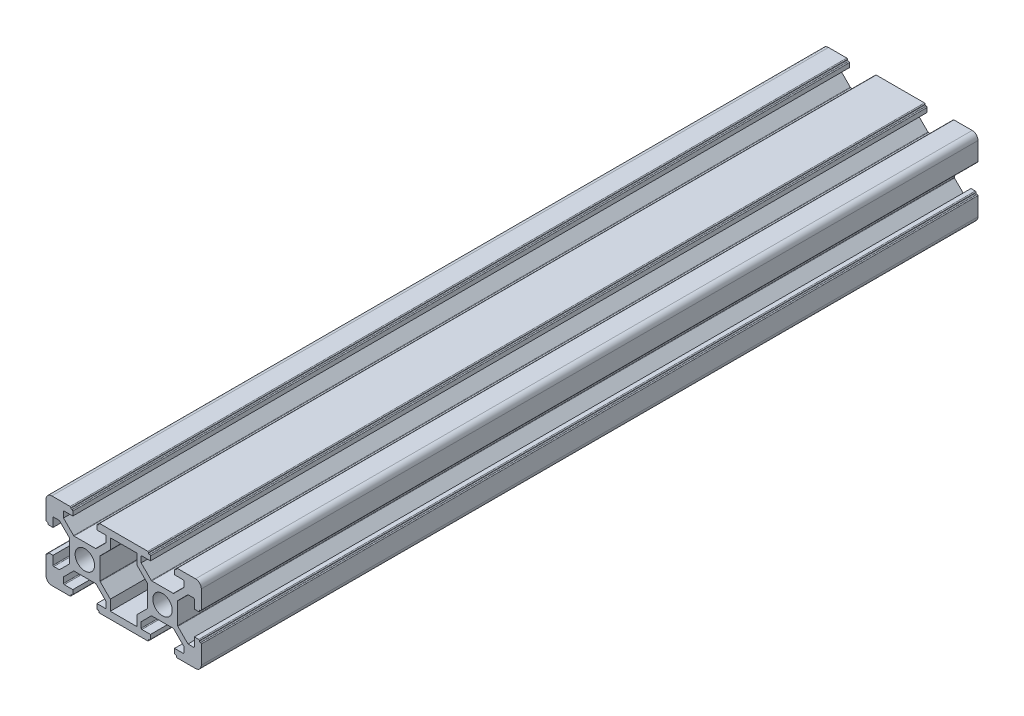
from build123d import *

# Parameters (mm, degrees)
BOSS_EXTRUDE1_DEPTH = 200
SKETCH2_R           = 2.5
CUT_EXTRUDE1_DEPTH  = 203.484567313
SKETCH3_R           = 1.5
CUT_EXTRUDE2_DEPTH  = 10
CUT_EXTRUDE3_DEPTH  = 1


with BuildPart() as part:
    # Sketch1 → Boss-Extrude1 (new body)
    with BuildSketch(Plane.XY):
        with BuildLine():
            Line((-8.5, 10), (-3.8, 10))
            ThreePointArc((-3.8, 10), (-3.658578644, 9.941421356), (-3.6, 9.8))
            Line((-3.6, 9.8), (-3.6, 9.7))
            ThreePointArc((-3.6, 9.7), (-3.541421356, 9.558578644), (-3.4, 9.5))
            Line((-3.4, 9.5), (-3.3, 9.5))
            ThreePointArc((-3.3, 9.5), (-3.158578644, 9.441421356), (-3.1, 9.3))
            Line((-3.1, 9.3), (-3.1, 8.2))
            Line((-3.1, 8.2), (-5.3, 8.2))
            ThreePointArc((-5.3, 8.2), (-5.441421356, 8.141421356), (-5.5, 8))
            Line((-5.5, 8), (-5.5, 6.560660172))
            Line((-5.5, 6.560660172), (-2.897918472, 3.958578644))
            ThreePointArc((-2.897918472, 3.958578644), (-2.833033802, 3.915224093), (-2.756497116, 3.9))
            Line((-2.756497116, 3.9), (2.756497116, 3.9))
            ThreePointArc((2.756497116, 3.9), (2.833033802, 3.915224093), (2.897918472, 3.958578644))
            Line((2.897918472, 3.958578644), (5.5, 6.560660172))
            Line((5.5, 6.560660172), (5.5, 8))
            ThreePointArc((5.5, 8), (5.441421356, 8.141421356), (5.3, 8.2))
            Line((5.3, 8.2), (3.1, 8.2))
            Line((3.1, 8.2), (3.1, 9.3))
            ThreePointArc((3.1, 9.3), (3.158578644, 9.441421356), (3.3, 9.5))
            Line((3.3, 9.5), (3.4, 9.5))
            ThreePointArc((3.4, 9.5), (3.541421356, 9.558578644), (3.6, 9.7))
            Line((3.6, 9.7), (3.6, 9.8))
            ThreePointArc((3.6, 9.8), (3.658578644, 9.941421356), (3.8, 10))
            Line((3.8, 10), (8.5, 10))
            Line((8.5, 10), (11.5, 10))
            Line((11.5, 10), (16.2, 10))
            ThreePointArc((16.2, 10), (16.341421356, 9.941421356), (16.4, 9.8))
            Line((16.4, 9.8), (16.4, 9.7))
            ThreePointArc((16.4, 9.7), (16.458578644, 9.558578644), (16.6, 9.5))
            Line((16.6, 9.5), (16.7, 9.5))
            ThreePointArc((16.7, 9.5), (16.841421356, 9.441421356), (16.9, 9.3))
            Line((16.9, 9.3), (16.9, 8.2))
            Line((16.9, 8.2), (14.7, 8.2))
            ThreePointArc((14.7, 8.2), (14.558578644, 8.141421356), (14.5, 8))
            Line((14.5, 8), (14.5, 6.560660172))
            Line((14.5, 6.560660172), (17.102081528, 3.958578644))
            ThreePointArc((17.102081528, 3.958578644), (17.166966198, 3.915224093), (17.243502884, 3.9))
            Line((17.243502884, 3.9), (22.756497116, 3.9))
            ThreePointArc((22.756497116, 3.9), (22.833033802, 3.915224093), (22.897918472, 3.958578644))
            Line((22.897918472, 3.958578644), (25.5, 6.560660172))
            Line((25.5, 6.560660172), (25.5, 8))
            ThreePointArc((25.5, 8), (25.441421356, 8.141421356), (25.3, 8.2))
            Line((25.3, 8.2), (23.1, 8.2))
            Line((23.1, 8.2), (23.1, 9.3))
            ThreePointArc((23.1, 9.3), (23.158578644, 9.441421356), (23.3, 9.5))
            Line((23.3, 9.5), (23.4, 9.5))
            ThreePointArc((23.4, 9.5), (23.541421356, 9.558578644), (23.6, 9.7))
            Line((23.6, 9.7), (23.6, 9.8))
            ThreePointArc((23.6, 9.8), (23.658578644, 9.941421356), (23.8, 10))
            Line((23.8, 10), (28.5, 10))
            ThreePointArc((28.5, 10), (29.560660172, 9.560660172), (30, 8.5))
            Line((30, 8.5), (30, 3.8))
            ThreePointArc((30, 3.8), (29.941421356, 3.658578644), (29.8, 3.6))
            Line((29.8, 3.6), (29.7, 3.6))
            ThreePointArc((29.7, 3.6), (29.558578644, 3.541421356), (29.5, 3.4))
            Line((29.5, 3.4), (29.5, 3.3))
            ThreePointArc((29.5, 3.3), (29.441421356, 3.158578644), (29.3, 3.1))
            Line((29.3, 3.1), (28.2, 3.1))
            Line((28.2, 3.1), (28.2, 5.3))
            ThreePointArc((28.2, 5.3), (28.141421356, 5.441421356), (28, 5.5))
            Line((28, 5.5), (26.560660172, 5.5))
            Line((26.560660172, 5.5), (23.958578644, 2.897918472))
            ThreePointArc((23.958578644, 2.897918472), (23.915224093, 2.833033802), (23.9, 2.756497116))
            Line((23.9, 2.756497116), (23.9, -2.756497116))
            ThreePointArc((23.9, -2.756497116), (23.915224093, -2.833033802), (23.958578644, -2.897918472))
            Line((23.958578644, -2.897918472), (26.560660172, -5.5))
            Line((26.560660172, -5.5), (28, -5.5))
            ThreePointArc((28, -5.5), (28.141421356, -5.441421356), (28.2, -5.3))
            Line((28.2, -5.3), (28.2, -3.1))
            Line((28.2, -3.1), (29.3, -3.1))
            ThreePointArc((29.3, -3.1), (29.441421356, -3.158578644), (29.5, -3.3))
            Line((29.5, -3.3), (29.5, -3.4))
            ThreePointArc((29.5, -3.4), (29.558578644, -3.541421356), (29.7, -3.6))
            Line((29.7, -3.6), (29.8, -3.6))
            ThreePointArc((29.8, -3.6), (29.941421356, -3.658578644), (30, -3.8))
            Line((30, -3.8), (30, -8.5))
            ThreePointArc((30, -8.5), (29.560660172, -9.560660172), (28.5, -10))
            Line((28.5, -10), (23.8, -10))
            ThreePointArc((23.8, -10), (23.658578644, -9.941421356), (23.6, -9.8))
            Line((23.6, -9.8), (23.6, -9.7))
            ThreePointArc((23.6, -9.7), (23.541421356, -9.558578644), (23.4, -9.5))
            Line((23.4, -9.5), (23.3, -9.5))
            ThreePointArc((23.3, -9.5), (23.158578644, -9.441421356), (23.1, -9.3))
            Line((23.1, -9.3), (23.1, -8.2))
            Line((23.1, -8.2), (25.3, -8.2))
            ThreePointArc((25.3, -8.2), (25.441421356, -8.141421356), (25.5, -8))
            Line((25.5, -8), (25.5, -6.560660172))
            Line((25.5, -6.560660172), (22.897918472, -3.958578644))
            ThreePointArc((22.897918472, -3.958578644), (22.833033802, -3.915224093), (22.756497116, -3.9))
            Line((22.756497116, -3.9), (17.243502884, -3.9))
            ThreePointArc((17.243502884, -3.9), (17.166966198, -3.915224093), (17.102081528, -3.958578644))
            Line((17.102081528, -3.958578644), (14.5, -6.560660172))
            Line((14.5, -6.560660172), (14.5, -8))
            ThreePointArc((14.5, -8), (14.558578644, -8.141421356), (14.7, -8.2))
            Line((14.7, -8.2), (16.9, -8.2))
            Line((16.9, -8.2), (16.9, -9.3))
            ThreePointArc((16.9, -9.3), (16.841421356, -9.441421356), (16.7, -9.5))
            Line((16.7, -9.5), (16.6, -9.5))
            ThreePointArc((16.6, -9.5), (16.458578644, -9.558578644), (16.4, -9.7))
            Line((16.4, -9.7), (16.4, -9.8))
            ThreePointArc((16.4, -9.8), (16.341421356, -9.941421356), (16.2, -10))
            Line((16.2, -10), (11.5, -10))
            Line((11.5, -10), (8.5, -10))
            Line((8.5, -10), (3.8, -10))
            ThreePointArc((3.8, -10), (3.658578644, -9.941421356), (3.6, -9.8))
            Line((3.6, -9.8), (3.6, -9.7))
            ThreePointArc((3.6, -9.7), (3.541421356, -9.558578644), (3.4, -9.5))
            Line((3.4, -9.5), (3.3, -9.5))
            ThreePointArc((3.3, -9.5), (3.158578644, -9.441421356), (3.1, -9.3))
            Line((3.1, -9.3), (3.1, -8.2))
            Line((3.1, -8.2), (5.3, -8.2))
            ThreePointArc((5.3, -8.2), (5.441421356, -8.141421356), (5.5, -8))
            Line((5.5, -8), (5.5, -6.560660172))
            Line((5.5, -6.560660172), (2.897918472, -3.958578644))
            ThreePointArc((2.897918472, -3.958578644), (2.833033802, -3.915224093), (2.756497116, -3.9))
            Line((2.756497116, -3.9), (-2.756497116, -3.9))
            ThreePointArc((-2.756497116, -3.9), (-2.833033802, -3.915224093), (-2.897918472, -3.958578644))
            Line((-2.897918472, -3.958578644), (-5.5, -6.560660172))
            Line((-5.5, -6.560660172), (-5.5, -8))
            ThreePointArc((-5.5, -8), (-5.441421356, -8.141421356), (-5.3, -8.2))
            Line((-5.3, -8.2), (-3.1, -8.2))
            Line((-3.1, -8.2), (-3.1, -9.3))
            ThreePointArc((-3.1, -9.3), (-3.158578644, -9.441421356), (-3.3, -9.5))
            Line((-3.3, -9.5), (-3.4, -9.5))
            ThreePointArc((-3.4, -9.5), (-3.541421356, -9.558578644), (-3.6, -9.7))
            Line((-3.6, -9.7), (-3.6, -9.8))
            ThreePointArc((-3.6, -9.8), (-3.658578644, -9.941421356), (-3.8, -10))
            Line((-3.8, -10), (-8.5, -10))
            ThreePointArc((-8.5, -10), (-9.560660172, -9.560660172), (-10, -8.5))
            Line((-10, -8.5), (-10, -3.8))
            ThreePointArc((-10, -3.8), (-9.941421356, -3.658578644), (-9.8, -3.6))
            Line((-9.8, -3.6), (-9.7, -3.6))
            ThreePointArc((-9.7, -3.6), (-9.558578644, -3.541421356), (-9.5, -3.4))
            Line((-9.5, -3.4), (-9.5, -3.3))
            ThreePointArc((-9.5, -3.3), (-9.441421356, -3.158578644), (-9.3, -3.1))
            Line((-9.3, -3.1), (-8.2, -3.1))
            Line((-8.2, -3.1), (-8.2, -5.3))
            ThreePointArc((-8.2, -5.3), (-8.141421356, -5.441421356), (-8, -5.5))
            Line((-8, -5.5), (-6.560660172, -5.5))
            Line((-6.560660172, -5.5), (-3.958578644, -2.897918472))
            ThreePointArc((-3.958578644, -2.897918472), (-3.915224093, -2.833033802), (-3.9, -2.756497116))
            Line((-3.9, -2.756497116), (-3.9, 2.756497116))
            ThreePointArc((-3.9, 2.756497116), (-3.915224093, 2.833033802), (-3.958578644, 2.897918472))
            Line((-3.958578644, 2.897918472), (-6.560660172, 5.5))
            Line((-6.560660172, 5.5), (-8, 5.5))
            ThreePointArc((-8, 5.5), (-8.141421356, 5.441421356), (-8.2, 5.3))
            Line((-8.2, 5.3), (-8.2, 3.1))
            Line((-8.2, 3.1), (-9.3, 3.1))
            ThreePointArc((-9.3, 3.1), (-9.441421356, 3.158578644), (-9.5, 3.3))
            Line((-9.5, 3.3), (-9.5, 3.4))
            ThreePointArc((-9.5, 3.4), (-9.558578644, 3.541421356), (-9.7, 3.6))
            Line((-9.7, 3.6), (-9.8, 3.6))
            ThreePointArc((-9.8, 3.6), (-9.941421356, 3.658578644), (-10, 3.8))
            Line((-10, 3.8), (-10, 8.5))
            ThreePointArc((-10, 8.5), (-9.560660172, 9.560660172), (-8.5, 10))
        make_face()
        with BuildLine():
            Line((3.9, 2.756497116), (3.9, -2.756497116))
            ThreePointArc((3.9, -2.756497116), (3.915224093, -2.833033802), (3.958578644, -2.897918472))
            Line((3.958578644, -2.897918472), (6.560660172, -5.5))
            Line((6.560660172, -5.5), (6.560660172, -8.2))
            Line((6.560660172, -8.2), (13.439339828, -8.2))
            Line((13.439339828, -8.2), (13.439339828, -5.5))
            Line((13.439339828, -5.5), (16.041421356, -2.897918472))
            ThreePointArc((16.041421356, -2.897918472), (16.084775907, -2.833033802), (16.1, -2.756497116))
            Line((16.1, -2.756497116), (16.1, 2.756497116))
            ThreePointArc((16.1, 2.756497116), (16.084775907, 2.833033802), (16.041421356, 2.897918472))
            Line((16.041421356, 2.897918472), (13.439339828, 5.5))
            Line((13.439339828, 5.5), (13.439339828, 8.2))
            Line((13.439339828, 8.2), (6.560660172, 8.2))
            Line((6.560660172, 8.2), (6.560660172, 5.5))
            Line((6.560660172, 5.5), (3.958578644, 2.897918472))
            ThreePointArc((3.958578644, 2.897918472), (3.915224093, 2.833033802), (3.9, 2.756497116))
        make_face(mode=Mode.SUBTRACT)
    extrude(amount=BOSS_EXTRUDE1_DEPTH)

    # Sketch2 → Cut-Extrude1 (cut, through all)
    with BuildSketch(Plane.XY.offset(200)):
        Circle(SKETCH2_R)
        with Locations((20, 0)):
            Circle(SKETCH2_R)
    extrude(amount=-CUT_EXTRUDE1_DEPTH, mode=Mode.SUBTRACT)

    # Sketch3 → Cut-Extrude2 (cut)
    with BuildSketch(Plane.XZ.offset(3.9)):
        with Locations((20, 183.3)):
            Circle(SKETCH3_R)
        with Locations((20, 166.6)):
            Circle(SKETCH3_R)
        with Locations((0, 166.6)):
            Circle(SKETCH3_R)
        with Locations((0, 183.3)):
            Circle(SKETCH3_R)
    extrude(amount=-CUT_EXTRUDE2_DEPTH, mode=Mode.SUBTRACT)

    # Sketch4 → Cut-Extrude3 (cut)
    # profile 1 of 7: a face of its own
    with BuildSketch(Plane.XZ.offset(10)):
        with BuildLine():
            Line((5.405689325, 199.018538248), (4.398870658, 198.515128915))
            add(Edge.make_bspline(
                [(4.398870658, 198.515128915), (4.375470361, 198.504007187), (4.332287922, 198.483483372), (4.272890674, 198.454114045), (4.223964892, 198.429334287), (4.175163438, 198.401811983), (4.124432953, 198.37568004), (4.075408852, 198.36254351), (4.043274946, 198.358682258), (4.026000646, 198.35704289), (4.015934415, 198.356490843), (4.007102707, 198.357946256), (4.009027033, 198.366735391), (4.010780376, 198.371430848), (4.011804816, 198.374174302)],
                knots=[0, 0, 0, 0, 2.113482073, 3.900177315, 5.405807338, 6.585701353, 8.47248579, 10.046621559, 10.680507243, 11.128502661, 11.432699657, 11.560960372, 11.74347857, 12, 12, 12, 12], degree=3))
            add(Edge.make_bspline(
                [(4.011804816, 198.374174302), (4.012253079, 198.380189599), (4.013076615, 198.391240727), (4.019572333, 198.409113814), (4.036067403, 198.42879124), (4.04867769, 198.444752576), (4.056552312, 198.454719795)],
                knots=[0, 0, 0, 0, 0.76500436, 1.405443559, 2.379802743, 4, 4, 4, 4], degree=3))
            Line((4.056552312, 198.454719795), (4.142318346, 198.570317494))
            add(Edge.make_bspline(
                [(4.142318346, 198.570317494), (4.15329164, 198.586113956), (4.172345099, 198.613542117), (4.199206632, 198.647089641), (4.215949289, 198.669007008), (4.229005362, 198.681559753), (4.24333129, 198.683175519), (4.261250243, 198.685834774), (4.287282369, 198.686727747), (4.320596735, 198.688042176), (4.360200719, 198.691165548), (4.404361497, 198.700587741), (4.452258254, 198.715172829), (4.520188989, 198.739676534), (4.602153471, 198.774120727), (4.666179305, 198.803356193), (4.696441509, 198.817174515)],
                knots=[0, 0, 0, 0, 1.27946367, 2.221594617, 2.843686471, 3.137924783, 3.374542097, 3.774254406, 4.353610435, 5.098017717, 5.994242814, 6.989243992, 8.092537102, 9.32092557, 11.788406741, 14, 14, 14, 14], degree=3))
            Line((4.696441509, 198.817174515), (5.240123588, 199.093863201))
            Line((5.240123588, 199.093863201), (4.328766248, 199.536863414))
            Line((4.328766248, 199.536863414), (4.112486682, 199.647240571))
            add(Edge.make_bspline(
                [(4.112486682, 199.647240571), (4.097898348, 199.655501066), (4.070009846, 199.671292643), (4.038919052, 199.692667929), (4.017120497, 199.707598639), (4.009217413, 199.71634861), (4.002107957, 199.723193104), (4.008116126, 199.731210193), (4.021424767, 199.73363871), (4.036512774, 199.740512061), (4.054434497, 199.744047682), (4.074177091, 199.745236018), (4.099084921, 199.745155522), (4.117462818, 199.744047151), (4.127402514, 199.743447688)],
                knots=[0, 0, 0, 0, 2.288612866, 4.375138456, 5.226165039, 5.803861041, 6.12500379, 6.323495593, 6.994026778, 7.930620101, 8.591577993, 9.479260322, 10.636656475, 12, 12, 12, 12], degree=3))
            Line((4.127402514, 199.743447688), (4.257916045, 199.733006606))
            Line((4.257916045, 199.733006606), (4.434668655, 199.718090773))
            add(Edge.make_bspline(
                [(4.434668655, 199.718090773), (4.442798302, 199.717743015), (4.455997342, 199.717178404), (4.472512014, 199.715086219), (4.481778019, 199.706808802), (4.486840316, 199.694517903), (4.494639887, 199.677910897), (4.50171184, 199.655674874), (4.513291828, 199.630467306), (4.533667941, 199.606610137), (4.558240915, 199.581083988), (4.603682973, 199.549072968), (4.671125734, 199.508908743), (4.729979723, 199.480920017), (4.761325378, 199.466013211)],
                knots=[0, 0, 0, 0, 0.684866172, 1.111927356, 1.332136251, 1.684299924, 2.203842278, 2.865766853, 3.625492481, 4.495790489, 5.462563622, 6.5729227, 9.109536716, 12, 12, 12, 12], degree=3))
            Line((4.761325378, 199.466013211), (5.381078202, 199.179629235))
            Line((5.381078202, 199.179629235), (6.025442148, 199.481674835))
            add(Edge.make_bspline(
                [(6.025442148, 199.481674835), (6.05530856, 199.496272179), (6.108947914, 199.522488657), (6.180320583, 199.558497987), (6.233692898, 199.586302366), (6.281250563, 199.613305969), (6.327826598, 199.644610778), (6.375662216, 199.683450324), (6.41605415, 199.717956353), (6.439153764, 199.73941885), (6.448305988, 199.747922438)],
                knots=[0, 0, 0, 0, 1.58777371, 2.851603225, 3.818285944, 4.461889746, 5.463034698, 6.494081497, 7.403344846, 8, 8, 8, 8], degree=3))
            Line((6.448305988, 199.747922438), (6.488578734, 199.793415726))
            Line((6.488578734, 199.793415726), (6.548987854, 199.768058811))
            Line((6.548987854, 199.768058811), (6.468442361, 199.476454294))
            add(Edge.make_bspline(
                [(6.468442361, 199.476454294), (6.454765304, 199.476160185), (6.430330339, 199.475634742), (6.396247104, 199.472183634), (6.36632575, 199.464467027), (6.33957438, 199.45683859), (6.310871469, 199.44563242), (6.275913336, 199.430777178), (6.228102187, 199.407721606), (6.191526816, 199.390639686), (6.170871511, 199.380992968)],
                knots=[0, 0, 0, 0, 1.039349584, 1.856866603, 2.594340973, 3.382992685, 3.968725486, 4.933329466, 6.268151062, 8, 8, 8, 8], degree=3))
            Line((6.170871511, 199.380992968), (5.546643938, 199.099083742))
            Line((5.546643938, 199.099083742), (6.201448967, 198.781376518))
            add(Edge.make_bspline(
                [(6.201448967, 198.781376518), (6.216388546, 198.77446763), (6.244045917, 198.761677332), (6.281972644, 198.743244362), (6.314469997, 198.72952267), (6.35069139, 198.712203074), (6.399600412, 198.694102045), (6.46236425, 198.676183856), (6.52343932, 198.660223428), (6.562369955, 198.653643316), (6.578819518, 198.650862987)],
                knots=[0, 0, 0, 0, 0.985086527, 1.823672732, 2.523088216, 3.095642457, 4.225768838, 5.637986055, 7.001965939, 8, 8, 8, 8], degree=3))
            Line((6.578819518, 198.650862987), (6.664585553, 198.645642446))
            Line((6.664585553, 198.645642446), (6.674280844, 198.590453867))
            Line((6.674280844, 198.590453867), (6.241721713, 198.504687833))
            add(Edge.make_bspline(
                [(6.241721713, 198.504687833), (6.23823433, 198.514371131), (6.231574374, 198.532863604), (6.221091921, 198.562518515), (6.198785569, 198.594606518), (6.15959203, 198.630369869), (6.100961347, 198.670859724), (6.052495107, 198.693444925), (6.025442148, 198.706051566)],
                knots=[0, 0, 0, 0, 0.60425042, 1.153954364, 1.837467463, 2.868811726, 4.252228599, 6, 6, 6, 6], degree=3))
            Line((6.025442148, 198.706051566), (5.405689325, 199.018538248))
        make_face()
    # profile 2 of 7: a face of its own
    with BuildSketch(Plane.XZ.offset(10)):
        with BuildLine():
            add(Edge.make_bspline(
                [(4.4040912, 196.055508204), (4.384216489, 196.057882732), (4.346997055, 196.062329519), (4.294245342, 196.066571171), (4.248510275, 196.070056996), (4.198756615, 196.070466993), (4.146956296, 196.071176363), (4.102335148, 196.077261002), (4.07415018, 196.084260026), (4.062177042, 196.090169095), (4.053422268, 196.097553171), (4.055523495, 196.102872), (4.056552312, 196.105476241)],
                knots=[0, 0, 0, 0, 1.654098457, 3.097635461, 4.374174197, 5.442795876, 7.210879807, 8.643407929, 9.176829156, 9.572051243, 9.790464788, 10, 10, 10, 10], degree=3))
            add(Edge.make_bspline(
                [(4.056552312, 196.105476241), (4.057302367, 196.106466384), (4.060512786, 196.110704437), (4.06738508, 196.121029708), (4.086100252, 196.132617716), (4.102626873, 196.137572447), (4.112486682, 196.140528447)],
                knots=[0, 0, 0, 0, 0.220129113, 0.942206293, 2.175715252, 4, 4, 4, 4], degree=3))
            Line((4.112486682, 196.140528447), (4.177370552, 196.165885361))
            Line((4.177370552, 196.165885361), (4.389175368, 196.236735564))
            add(Edge.make_bspline(
                [(4.389175368, 196.236735564), (4.400593788, 196.240264982), (4.42111392, 196.246607727), (4.448372499, 196.254339678), (4.468818525, 196.258367632), (4.48834553, 196.259969011), (4.511832299, 196.253553249), (4.542612438, 196.23943904), (4.583441094, 196.225051471), (4.631568032, 196.210577435), (4.68327943, 196.198619484), (4.730132299, 196.19331978), (4.775985927, 196.191755609), (4.82770538, 196.190416568), (4.897049566, 196.187912278), (4.949262909, 196.186698131), (4.978350735, 196.186021734)],
                knots=[0, 0, 0, 0, 0.834378348, 1.499467721, 1.97595881, 2.288790536, 2.857210041, 3.64346534, 4.659010869, 5.872341409, 7.15221937, 8.357582129, 9.156564213, 10.354409044, 11.969057202, 14, 14, 14, 14], degree=3))
            Line((4.978350735, 196.186021734), (6.780183252, 196.180801193))
            add(Edge.make_bspline(
                [(6.780183252, 196.180801193), (6.818222881, 196.18131292), (6.889617281, 196.18227335), (6.991667487, 196.187184874), (7.085337941, 196.196849738), (7.159150604, 196.205877921), (7.21351823, 196.21391693), (7.246757316, 196.219371267), (7.272939198, 196.222822902), (7.28782293, 196.225272362), (7.294033667, 196.226294481)],
                knots=[0, 0, 0, 0, 1.76776236, 3.317811778, 4.745426959, 6.142428608, 6.773033178, 7.299115075, 7.707532242, 8, 8, 8, 8], degree=3))
            Line((7.294033667, 196.226294481), (7.37457916, 196.251651396))
            Line((7.37457916, 196.251651396), (7.424547198, 196.206158108))
            Line((7.424547198, 196.206158108), (7.122501598, 195.984658001))
            add(Edge.make_bspline(
                [(7.122501598, 195.984658001), (7.106792042, 195.989229505), (7.077266637, 195.99782144), (7.033452602, 196.013224174), (6.984523316, 196.025992372), (6.936000478, 196.034049936), (6.886662293, 196.039643793), (6.837930845, 196.043603894), (6.779437464, 196.044388221), (6.737174157, 196.044830435), (6.71455359, 196.045067121)],
                knots=[0, 0, 0, 0, 0.945941833, 1.777855114, 2.684418718, 3.866092074, 4.618573467, 5.555736068, 6.691757972, 8, 8, 8, 8], degree=3))
            Line((6.71455359, 196.045067121), (6.216364799, 196.045067121))
            add(Edge.make_bspline(
                [(6.216364799, 196.045067121), (6.228047757, 196.037609047), (6.254259347, 196.020876302), (6.289042842, 195.998688844), (6.320976338, 195.975618313), (6.348604695, 195.952674831), (6.377479106, 195.922979912), (6.408333712, 195.889182808), (6.437297735, 195.850312154), (6.461247121, 195.8068071), (6.475675563, 195.75840432), (6.48077237, 195.724944754), (6.483358193, 195.707969316)],
                knots=[0, 0, 0, 0, 0.929261729, 2.08486808, 2.76490863, 3.569370846, 4.488565088, 5.539043116, 6.635702196, 7.731727918, 8.849210703, 10, 10, 10, 10], degree=3))
            add(Edge.make_bspline(
                [(6.483358193, 195.707969316), (6.483964034, 195.688015301), (6.485181789, 195.647907207), (6.471304761, 195.58822165), (6.447253188, 195.529747137), (6.410907536, 195.47473936), (6.367396125, 195.42283613), (6.316720744, 195.376415158), (6.26088689, 195.334858228), (6.179001435, 195.290881849), (6.073882122, 195.247537053), (5.965381294, 195.217027418), (5.875415184, 195.201792714), (5.801403839, 195.190174151), (5.719439106, 195.181234907), (5.597383633, 195.167332262), (5.430748371, 195.155830796), (5.221289507, 195.150200009), (5.007488261, 195.152761624), (4.866170443, 195.167017291), (4.797123375, 195.173982527)],
                knots=[0, 0, 0, 0, 0.551888208, 1.109309806, 1.68450244, 2.298740058, 2.930242627, 3.559934216, 4.201491226, 4.856080764, 6.133284784, 7.349947576, 7.973717169, 8.664419706, 9.428487307, 10.26109817, 12.073136923, 14.060545576, 16.075205358, 18, 18, 18, 18], degree=3))
            add(Edge.make_bspline(
                [(4.797123375, 195.173982527), (4.761986631, 195.178984069), (4.694881383, 195.188536169), (4.60037292, 195.20948379), (4.515498917, 195.230096306), (4.44151369, 195.255446532), (4.37769018, 195.283645258), (4.321740428, 195.311466111), (4.274856394, 195.341936662), (4.224349131, 195.382958325), (4.176465257, 195.440651833), (4.138135764, 195.515591842), (4.11810568, 195.590558136), (4.117326779, 195.639513353), (4.116961432, 195.662476028)],
                knots=[0, 0, 0, 0, 1.381403856, 2.638248161, 3.767543458, 4.780811365, 5.678190839, 6.483442268, 7.211059005, 7.850603229, 9.01192915, 10.098557327, 11.108119387, 12, 12, 12, 12], degree=3))
            add(Edge.make_bspline(
                [(4.116961432, 195.662476028), (4.117550152, 195.677931043), (4.11874658, 195.709339527), (4.128320999, 195.756864877), (4.143438425, 195.805528076), (4.163661188, 195.854218467), (4.188748987, 195.900034866), (4.219657322, 195.938439058), (4.254147685, 195.96954379), (4.280694683, 195.983187367), (4.293714042, 195.989878543)],
                knots=[0, 0, 0, 0, 0.950081545, 1.930805051, 2.970780528, 4.081223131, 5.169973651, 6.170642917, 7.102834297, 8, 8, 8, 8], degree=3))
            Line((4.293714042, 195.989878543), (4.4040912, 196.055508204))
        make_face()
        with BuildLine():
            add(Edge.make_bspline(
                [(5.038759855, 196.050287662), (4.996489995, 196.050170535), (4.918114097, 196.049953358), (4.808063687, 196.044137844), (4.710382826, 196.033428906), (4.619244126, 196.014029216), (4.528765897, 195.981896212), (4.455821479, 195.941737622), (4.399915368, 195.903584685), (4.362778465, 195.87307867), (4.334739688, 195.839120558), (4.312308428, 195.80453357), (4.297151469, 195.767851029), (4.288136202, 195.729329635), (4.285221381, 195.688814329), (4.287390121, 195.661471352), (4.288493501, 195.647560196)],
                knots=[0, 0, 0, 0, 1.845917827, 3.422662539, 4.811160948, 6.133693706, 7.483401613, 8.989439591, 9.754418173, 10.439823622, 11.079316246, 11.669733515, 12.234328133, 12.803187042, 13.391103168, 14, 14, 14, 14], degree=3))
            add(Edge.make_bspline(
                [(4.288493501, 195.647560196), (4.290354556, 195.626207407), (4.2941286, 195.582905982), (4.316584073, 195.531205596), (4.345632005, 195.493106041), (4.376928656, 195.465114941), (4.416049909, 195.436921812), (4.462647001, 195.408606766), (4.516617039, 195.383364261), (4.575703602, 195.359766128), (4.640351925, 195.341034855), (4.70957892, 195.323378949), (4.784436077, 195.310501049), (4.864256458, 195.29974057), (4.9494463, 195.293656393), (5.067020119, 195.287639499), (5.209798048, 195.286745046), (5.322412195, 195.285633164), (5.37585766, 195.285105476)],
                knots=[0, 0, 0, 0, 0.824770147, 1.672555393, 2.131829284, 2.668927445, 3.287724202, 3.994607415, 4.772432371, 5.587803282, 6.451018784, 7.371474039, 8.34770517, 9.384513317, 10.483222405, 11.647207185, 13.934211268, 16, 16, 16, 16], degree=3))
            add(Edge.make_bspline(
                [(5.37585766, 195.285105476), (5.410428201, 195.286051306), (5.476643523, 195.287862919), (5.571080534, 195.295129802), (5.65652885, 195.30259933), (5.758901765, 195.317846967), (5.88150771, 195.344710789), (6.000529405, 195.380331502), (6.09050177, 195.414900482), (6.148762582, 195.444449087), (6.196192372, 195.478002456), (6.233709127, 195.514486432), (6.261980346, 195.552678634), (6.283074623, 195.590774652), (6.297676168, 195.628938663), (6.300660355, 195.654902643), (6.302130833, 195.667696569)],
                knots=[0, 0, 0, 0, 1.349924509, 2.585602747, 3.697158241, 4.69775731, 6.624226206, 8.59222397, 9.542016248, 10.384152841, 11.135554691, 11.801277911, 12.418545044, 12.98321311, 13.498971423, 14, 14, 14, 14], degree=3))
            add(Edge.make_bspline(
                [(6.302130833, 195.667696569), (6.301082134, 195.685691704), (6.299005892, 195.721318959), (6.283696158, 195.773059133), (6.257243765, 195.82089), (6.222587248, 195.864844758), (6.182090825, 195.902873179), (6.140633324, 195.93672926), (6.097876578, 195.963538486), (6.052445941, 195.983562353), (6.003597223, 195.999205546), (5.948536662, 196.012713142), (5.886163221, 196.023420597), (5.819423238, 196.032378654), (5.754830334, 196.040685474), (5.697799873, 196.045318854), (5.651625642, 196.050004356), (5.624214458, 196.050201697), (5.612273599, 196.050287662)],
                knots=[0, 0, 0, 0, 0.989563793, 1.959165217, 2.938464336, 3.98106769, 5.025912143, 5.98941508, 6.923231245, 7.792710274, 8.714120056, 9.742628643, 10.90987881, 12.194436095, 13.448327045, 14.492365256, 15.343244234, 16, 16, 16, 16], degree=3))
            Line((5.612273599, 196.050287662), (5.038759855, 196.050287662))
        make_face(mode=Mode.SUBTRACT)
    # profile 3 of 7: a face of its own
    with BuildSketch(Plane.XZ.offset(10)):
        with BuildLine():
            add(Edge.make_bspline(
                [(5.335584914, 194.842105263), (5.377366057, 194.840418465), (5.458529526, 194.837141715), (5.57645225, 194.827391018), (5.686684816, 194.8141199), (5.78912589, 194.797402146), (5.883427148, 194.775593197), (5.969943433, 194.75050458), (6.048975081, 194.72165618), (6.119555611, 194.687913112), (6.182627318, 194.652244891), (6.240094134, 194.61912074), (6.291103808, 194.586814552), (6.33601044, 194.5562056), (6.373328973, 194.524841356), (6.405823853, 194.496369086), (6.431438063, 194.468119809), (6.455776323, 194.432529869), (6.477947949, 194.390332241), (6.497903836, 194.341965), (6.510831595, 194.296611844), (6.512434409, 194.266923025), (6.513189857, 194.252929896)],
                knots=[0, 0, 0, 0, 1.764634521, 3.427954541, 4.992196183, 6.449700333, 7.806241009, 9.074501551, 10.249686689, 11.352583265, 12.371647559, 13.307368702, 14.151493099, 14.919911991, 15.598324322, 16.207396272, 16.742379693, 17.202230901, 18.023686107, 18.748462212, 19.410116977, 20, 20, 20, 20], degree=3))
            add(Edge.make_bspline(
                [(6.513189857, 194.252929896), (6.511371977, 194.238925455), (6.507567459, 194.209616521), (6.492810291, 194.164919625), (6.468643594, 194.118694417), (6.443702107, 194.077981042), (6.416244857, 194.044452643), (6.388459568, 194.018053239), (6.354599811, 193.989972738), (6.313254059, 193.96239625), (6.266249607, 193.93196671), (6.211850899, 193.902036777), (6.151241729, 193.870573095), (6.08426293, 193.838264483), (6.009987736, 193.807370315), (5.927571487, 193.781583707), (5.837623981, 193.759954468), (5.739947984, 193.743104382), (5.634646232, 193.730471271), (5.521642655, 193.722757298), (5.401005485, 193.717717617), (5.317938786, 193.719018962), (5.275175794, 193.719688898)],
                knots=[0, 0, 0, 0, 0.583563041, 1.221299034, 1.934495109, 2.739387755, 3.192559802, 3.723702059, 4.323104031, 5.010912353, 5.778717214, 6.640149723, 7.578909276, 8.605156425, 9.717149955, 10.904820149, 12.175010999, 13.543452273, 15.004670893, 16.562387688, 18.230306584, 20, 20, 20, 20], degree=3))
            add(Edge.make_bspline(
                [(5.275175794, 193.719688898), (5.231653366, 193.721361465), (5.147506608, 193.724595224), (5.025870942, 193.734419044), (4.91279889, 193.74737292), (4.808339843, 193.765503037), (4.712204204, 193.786366541), (4.625135079, 193.812830797), (4.546423431, 193.842300533), (4.476310842, 193.87617005), (4.413870699, 193.911471797), (4.357944928, 193.945638802), (4.308557003, 193.978644257), (4.264897868, 194.009775065), (4.227710975, 194.040376834), (4.19622224, 194.069161628), (4.171083553, 194.096632697), (4.147618861, 194.131444385), (4.126380817, 194.173338914), (4.108514582, 194.221942174), (4.096433502, 194.268249271), (4.096697106, 194.298604622), (4.096825059, 194.313339016)],
                knots=[0, 0, 0, 0, 1.8254638, 3.529372482, 5.113983704, 6.594112102, 7.971884292, 9.234466531, 10.405306527, 11.491273865, 12.494282261, 13.411094474, 14.237657955, 14.98385902, 15.657644954, 16.254885857, 16.771507737, 17.213728076, 18.010662647, 18.732680123, 19.384846856, 20, 20, 20, 20], degree=3))
            add(Edge.make_bspline(
                [(4.096825059, 194.313339016), (4.097670995, 194.328122586), (4.099428288, 194.358832998), (4.115347976, 194.404793167), (4.137645866, 194.452912943), (4.1639954, 194.493660027), (4.192372861, 194.52696685), (4.220656401, 194.553739763), (4.256500029, 194.58027675), (4.297864911, 194.608883887), (4.346907306, 194.636477814), (4.401178795, 194.667144418), (4.463589072, 194.696048557), (4.531366438, 194.728092817), (4.60697521, 194.757171264), (4.689689546, 194.782375361), (4.779873432, 194.803361901), (4.877118822, 194.819103453), (4.981564992, 194.832146151), (5.09308431, 194.839950287), (5.212008087, 194.843821819), (5.293570229, 194.842688872), (5.335584914, 194.842105263)],
                knots=[0, 0, 0, 0, 0.609092621, 1.265288736, 1.99124151, 2.800277882, 3.259249877, 3.796866187, 4.404918809, 5.099990968, 5.873295192, 6.728228889, 7.674521439, 8.713227137, 9.825209791, 11.01753237, 12.283114261, 13.647408312, 15.085663506, 16.630395189, 18.264232863, 20, 20, 20, 20], degree=3))
        make_face()
        with BuildLine():
            add(Edge.make_bspline(
                [(5.325143831, 194.695930109), (5.289348037, 194.696966784), (5.219997284, 194.698975239), (5.119012169, 194.697130871), (5.024443958, 194.693107354), (4.936331797, 194.684939597), (4.854849608, 194.673301112), (4.780017412, 194.657334744), (4.711195444, 194.639389433), (4.632234881, 194.610017807), (4.547807997, 194.573005578), (4.462794234, 194.529686885), (4.399095123, 194.488712035), (4.354826322, 194.448744935), (4.328447389, 194.408895708), (4.30818295, 194.37348788), (4.296082621, 194.338216425), (4.294485913, 194.314910251), (4.293714042, 194.303643725)],
                knots=[0, 0, 0, 0, 1.450292897, 2.809796688, 4.090023312, 5.283351425, 6.392665891, 7.421558502, 8.381527156, 9.270195791, 10.830384, 12.113972103, 13.130522017, 13.892668432, 14.507225389, 15.056901841, 15.544093346, 16, 16, 16, 16], degree=3))
            add(Edge.make_bspline(
                [(4.293714042, 194.303643725), (4.293390915, 194.293131286), (4.292717008, 194.27120682), (4.303459684, 194.237975179), (4.31820448, 194.20230092), (4.342121676, 194.163256205), (4.382276487, 194.122176196), (4.441577156, 194.078898297), (4.521562662, 194.031994847), (4.60074827, 193.989602726), (4.6760854, 193.956828378), (4.742217989, 193.934574463), (4.815268602, 193.915431902), (4.895205342, 193.899126211), (4.982075185, 193.885848197), (5.075852711, 193.875257562), (5.176922692, 193.869268942), (5.28282794, 193.864170669), (5.390310175, 193.864601946), (5.495316329, 193.867933932), (5.59613567, 193.876048731), (5.692389827, 193.888905256), (5.78435939, 193.904962609), (5.871983179, 193.926011871), (5.955462812, 193.951062147), (6.008896753, 193.9714497), (6.035137439, 193.981461752)],
                knots=[0, 0, 0, 0, 0.390008479, 0.813391427, 1.287566515, 1.833704639, 2.510111583, 3.418024472, 4.567503627, 5.970969343, 6.769385843, 7.632481783, 8.573717181, 9.587807216, 10.677555774, 11.854447898, 13.110473302, 14.457701576, 15.81306122, 17.122827165, 18.380224076, 19.588121829, 20.7480868, 21.864901124, 22.951481802, 24, 24, 24, 24], degree=3))
            add(Edge.make_bspline(
                [(6.035137439, 193.981461752), (6.059951679, 193.992745247), (6.106166627, 194.013760041), (6.167599549, 194.048840074), (6.21705344, 194.083135218), (6.253203202, 194.119478829), (6.279623355, 194.154727614), (6.298345559, 194.188809468), (6.312114148, 194.220927758), (6.315459061, 194.242629533), (6.317046665, 194.252929896)],
                knots=[0, 0, 0, 0, 1.597305255, 2.974879719, 4.143993945, 5.112783108, 5.966898527, 6.717206142, 7.391144642, 8, 8, 8, 8], degree=3))
            add(Edge.make_bspline(
                [(6.317046665, 194.252929896), (6.316543662, 194.264198373), (6.315494641, 194.287698957), (6.303780753, 194.322925045), (6.287252276, 194.359731773), (6.263392983, 194.400111199), (6.223820011, 194.442660345), (6.163712074, 194.485932645), (6.083227107, 194.53299751), (6.002999787, 194.574440555), (5.926848239, 194.606424768), (5.860892636, 194.628700677), (5.787681129, 194.646946811), (5.708414867, 194.663550828), (5.621950851, 194.675988425), (5.529106369, 194.685204923), (5.429429684, 194.693282728), (5.360710471, 194.695027221), (5.325143831, 194.695930109)],
                knots=[0, 0, 0, 0, 0.462097373, 0.963711245, 1.513106502, 2.123568951, 2.883856956, 3.884212733, 5.159498054, 6.719369627, 7.595087039, 8.555749695, 9.580337177, 10.697680962, 11.886741469, 13.17219998, 14.536430512, 16, 16, 16, 16], degree=3))
        make_face(mode=Mode.SUBTRACT)
    # profile 4 of 7: a face of its own
    with BuildSketch(Plane.XZ.offset(10)):
        with BuildLine():
            add(Edge.make_bspline(
                [(6.362539953, 192.838909013), (6.362732716, 192.834687736), (6.363074363, 192.827206079), (6.364534932, 192.814536892), (6.373489968, 192.797634309), (6.378985614, 192.783064204), (6.382676326, 192.773279352)],
                knots=[0, 0, 0, 0, 0.732822287, 1.298830485, 2.185974516, 4, 4, 4, 4], degree=3))
            Line((6.382676326, 192.773279352), (6.412507991, 192.677818027))
            add(Edge.make_bspline(
                [(6.412507991, 192.677818027), (6.416352702, 192.665341973), (6.424509014, 192.638874817), (6.439294867, 192.600470612), (6.45496111, 192.565478921), (6.467518695, 192.545466577), (6.472917111, 192.536863414)],
                knots=[0, 0, 0, 0, 1.017807471, 2.159213881, 3.208659257, 4, 4, 4, 4], degree=3))
            Line((6.472917111, 192.536863414), (6.503494566, 192.491370126))
            Line((6.503494566, 192.491370126), (6.362539953, 192.345940763))
            add(Edge.make_bspline(
                [(6.362539953, 192.345940763), (6.355174689, 192.340464204), (6.342240785, 192.330846997), (6.320881021, 192.32427767), (6.303926614, 192.327896532), (6.287961989, 192.331775174), (6.276965607, 192.348749912), (6.276845218, 192.362442555), (6.276773919, 192.370551886)],
                knots=[0, 0, 0, 0, 1.377425141, 2.418851921, 3.210888427, 3.966904226, 4.795919252, 6, 6, 6, 6], degree=3))
            Line((6.276773919, 192.370551886), (6.267078628, 192.446622629))
            add(Edge.make_bspline(
                [(6.267078628, 192.446622629), (6.263124374, 192.4689997), (6.254766943, 192.516294292), (6.240947656, 192.591609771), (6.221604389, 192.674593896), (6.208375932, 192.733000143), (6.201448967, 192.763584061)],
                knots=[0, 0, 0, 0, 0.842298951, 1.780223452, 2.837633525, 4, 4, 4, 4], degree=3))
            Line((6.201448967, 192.763584061), (6.186533134, 192.838909013))
            Line((6.186533134, 192.838909013), (4.726273173, 192.838909013))
            add(Edge.make_bspline(
                [(4.726273173, 192.838909013), (4.690467849, 192.838415064), (4.626021288, 192.837525997), (4.540047848, 192.833069767), (4.475303461, 192.824689272), (4.419744235, 192.807982732), (4.372624426, 192.778886107), (4.337623065, 192.744346762), (4.319193859, 192.71242219), (4.313253363, 192.685083116), (4.309497151, 192.654946704), (4.312343999, 192.63381261), (4.313850416, 192.622629448)],
                knots=[0, 0, 0, 0, 1.991945531, 3.585333911, 4.788221947, 5.614901597, 6.793697312, 7.830482769, 8.319445486, 8.819240969, 9.375198244, 10, 10, 10, 10], degree=3))
            add(Edge.make_bspline(
                [(4.313850416, 192.622629448), (4.315183999, 192.611616349), (4.317757878, 192.590360551), (4.32804376, 192.560851848), (4.344505567, 192.536142192), (4.366034506, 192.514778403), (4.396246611, 192.499278796), (4.433913498, 192.486765932), (4.48034825, 192.478273516), (4.535527812, 192.473672851), (4.600245633, 192.470445545), (4.675040221, 192.465619141), (4.760340539, 192.461465687), (4.820493737, 192.45809883), (4.852311954, 192.45631792)],
                knots=[0, 0, 0, 0, 0.647618369, 1.249933885, 1.806296213, 2.37169955, 3.002794319, 3.770444153, 4.688388767, 5.75436937, 7.006559047, 8.477262984, 10.136637587, 12, 12, 12, 12], degree=3))
            Line((4.852311954, 192.45631792), (5.154357554, 192.446622629))
            Line((5.154357554, 192.446622629), (5.154357554, 192.380992968))
            Line((5.154357554, 192.380992968), (4.857532495, 192.380992968))
            add(Edge.make_bspline(
                [(4.857532495, 192.380992968), (4.81850246, 192.380999943), (4.746657364, 192.381012781), (4.647967412, 192.380933025), (4.567661736, 192.381156276), (4.48582972, 192.380410107), (4.397097729, 192.384838885), (4.314993425, 192.40261664), (4.254079314, 192.422332011), (4.215720167, 192.443814311), (4.18282017, 192.468480368), (4.156202112, 192.497926111), (4.136296884, 192.532229151), (4.124240605, 192.57098856), (4.116066529, 192.613090299), (4.116656257, 192.642475371), (4.116961432, 192.657681654)],
                knots=[0, 0, 0, 0, 1.823749578, 3.357093172, 4.611647022, 5.575794888, 7.182241415, 8.749702164, 9.48813326, 10.163974811, 10.79361356, 11.402331104, 12.006040373, 12.630514535, 13.291314191, 14, 14, 14, 14], degree=3))
            add(Edge.make_bspline(
                [(4.116961432, 192.657681654), (4.117592532, 192.676879296), (4.118785182, 192.713158921), (4.129959529, 192.76461964), (4.149573957, 192.809019803), (4.176177772, 192.847827096), (4.212013305, 192.879803289), (4.255915441, 192.90642323), (4.307816838, 192.928894518), (4.368424978, 192.945494245), (4.437253017, 192.958732915), (4.514482155, 192.968316155), (4.600174639, 192.973090338), (4.659892758, 192.974108799), (4.691220967, 192.974643085)],
                knots=[0, 0, 0, 0, 0.926718426, 1.751308632, 2.525651666, 3.258655965, 4.006755261, 4.826608924, 5.730237509, 6.729958161, 7.855828576, 9.114589967, 10.486309822, 12, 12, 12, 12], degree=3))
            Line((4.691220967, 192.974643085), (6.155955679, 192.979863627))
            Line((6.155955679, 192.979863627), (6.095546559, 193.272213936))
            add(Edge.make_bspline(
                [(6.095546559, 193.272213936), (6.108353798, 193.287980886), (6.132593198, 193.317821932), (6.169008619, 193.358776956), (6.205856187, 193.392881179), (6.246023874, 193.412136448), (6.276757527, 193.422138798), (6.300175012, 193.425754785), (6.31173075, 193.415078913), (6.315156274, 193.407119762), (6.317046665, 193.402727466)],
                knots=[0, 0, 0, 0, 1.679063987, 3.177851322, 4.533357148, 5.801920529, 6.790247391, 7.283555128, 7.60462651, 8, 8, 8, 8], degree=3))
            Line((6.317046665, 193.402727466), (6.307351374, 193.327402514))
            Line((6.307351374, 193.327402514), (6.307351374, 193.256552312))
            add(Edge.make_bspline(
                [(6.307351374, 193.256552312), (6.307292585, 193.237396179), (6.307181831, 193.201307914), (6.304197774, 193.151000305), (6.303154136, 193.107704357), (6.309147594, 193.082233402), (6.311826124, 193.070850202)],
                knots=[0, 0, 0, 0, 1.23233348, 2.321594721, 3.24990559, 4, 4, 4, 4], degree=3))
            Line((6.311826124, 193.070850202), (6.331962497, 192.974643085))
            Line((6.331962497, 192.974643085), (6.719774132, 192.974643085))
            add(Edge.make_bspline(
                [(6.719774132, 192.974643085), (6.757813929, 192.975153652), (6.829208643, 192.976111905), (6.931256767, 192.981037849), (7.024934269, 192.990653903), (7.098970266, 192.999856174), (7.153618126, 193.007676026), (7.187573844, 193.013341445), (7.214999152, 193.016766499), (7.231141501, 193.019121362), (7.238099297, 193.020136373)],
                knots=[0, 0, 0, 0, 1.752737237, 3.289611987, 4.705093132, 6.090220945, 6.726797833, 7.248408289, 7.676043345, 8, 8, 8, 8], degree=3))
            Line((7.238099297, 193.020136373), (7.31864479, 193.045493288))
            Line((7.31864479, 193.045493288), (7.369358619, 193))
            Line((7.369358619, 193), (7.067313019, 192.778499893))
            add(Edge.make_bspline(
                [(7.067313019, 192.778499893), (7.050500315, 192.784750455), (7.019884406, 192.796132718), (6.97356046, 192.808701262), (6.924982881, 192.820314453), (6.883502312, 192.827081512), (6.847592407, 192.831123165), (6.819474471, 192.833139359), (6.783694209, 192.83553942), (6.739919539, 192.836902521), (6.688202444, 192.837419303), (6.628539438, 192.83818421), (6.561171648, 192.839126187), (6.513687449, 192.83898413), (6.488578734, 192.838909013)],
                knots=[0, 0, 0, 0, 1.1017451, 2.006276124, 2.94760755, 4.170838528, 4.585895426, 5.168283219, 5.903080046, 6.789757156, 7.859358173, 9.081730106, 10.456875986, 12, 12, 12, 12], degree=3))
            Line((6.488578734, 192.838909013), (6.362539953, 192.838909013))
        make_face()
    # profile 5 of 7: a face of its own
    with BuildSketch(Plane.XZ.offset(10)):
        with BuildLine():
            add(Edge.make_bspline(
                [(6.362539953, 191.502450458), (6.362732716, 191.49822918), (6.363074363, 191.490747524), (6.364534932, 191.478078337), (6.373489968, 191.461175754), (6.378985614, 191.446605648), (6.382676326, 191.436820797)],
                knots=[0, 0, 0, 0, 0.732822287, 1.298830485, 2.185974516, 4, 4, 4, 4], degree=3))
            Line((6.382676326, 191.436820797), (6.412507991, 191.341359472))
            add(Edge.make_bspline(
                [(6.412507991, 191.341359472), (6.416352702, 191.328883418), (6.424509014, 191.302416262), (6.439294867, 191.264012057), (6.45496111, 191.229020366), (6.467518695, 191.209008021), (6.472917111, 191.200404858)],
                knots=[0, 0, 0, 0, 1.017807471, 2.159213881, 3.208659257, 4, 4, 4, 4], degree=3))
            Line((6.472917111, 191.200404858), (6.503494566, 191.15491157))
            Line((6.503494566, 191.15491157), (6.362539953, 191.009482208))
            add(Edge.make_bspline(
                [(6.362539953, 191.009482208), (6.355174689, 191.004005649), (6.342240785, 190.994388441), (6.320881021, 190.987819114), (6.303926614, 190.991437977), (6.287961989, 190.995316619), (6.276965607, 191.012291357), (6.276845218, 191.025983999), (6.276773919, 191.03409333)],
                knots=[0, 0, 0, 0, 1.377425141, 2.418851921, 3.210888427, 3.966904226, 4.795919252, 6, 6, 6, 6], degree=3))
            Line((6.276773919, 191.03409333), (6.267078628, 191.110164074))
            add(Edge.make_bspline(
                [(6.267078628, 191.110164074), (6.263124374, 191.132541145), (6.254766943, 191.179835737), (6.240947656, 191.255151216), (6.221604389, 191.338135341), (6.208375932, 191.396541588), (6.201448967, 191.427125506)],
                knots=[0, 0, 0, 0, 0.842298951, 1.780223452, 2.837633525, 4, 4, 4, 4], degree=3))
            Line((6.201448967, 191.427125506), (6.186533134, 191.502450458))
            Line((6.186533134, 191.502450458), (4.726273173, 191.502450458))
            add(Edge.make_bspline(
                [(4.726273173, 191.502450458), (4.690467849, 191.501956509), (4.626021288, 191.501067442), (4.540047848, 191.496611212), (4.475303461, 191.488230717), (4.419744235, 191.471524176), (4.372624426, 191.442427551), (4.337623065, 191.407888207), (4.319193859, 191.375963634), (4.313253363, 191.34862456), (4.309497151, 191.318488149), (4.312343999, 191.297354055), (4.313850416, 191.286170893)],
                knots=[0, 0, 0, 0, 1.991945531, 3.585333911, 4.788221947, 5.614901597, 6.793697312, 7.830482769, 8.319445486, 8.819240969, 9.375198244, 10, 10, 10, 10], degree=3))
            add(Edge.make_bspline(
                [(4.313850416, 191.286170893), (4.315183999, 191.275157794), (4.317757878, 191.253901996), (4.32804376, 191.224393293), (4.344505567, 191.199683637), (4.366034506, 191.178319847), (4.396246611, 191.162820241), (4.433913498, 191.150307377), (4.48034825, 191.141814961), (4.535527812, 191.137214296), (4.600245633, 191.133986989), (4.675040221, 191.129160586), (4.760340539, 191.125007132), (4.820493737, 191.121640274), (4.852311954, 191.119859365)],
                knots=[0, 0, 0, 0, 0.647618369, 1.249933885, 1.806296213, 2.37169955, 3.002794319, 3.770444153, 4.688388767, 5.75436937, 7.006559047, 8.477262984, 10.136637587, 12, 12, 12, 12], degree=3))
            Line((4.852311954, 191.119859365), (5.154357554, 191.110164074))
            Line((5.154357554, 191.110164074), (5.154357554, 191.044534413))
            Line((5.154357554, 191.044534413), (4.857532495, 191.044534413))
            add(Edge.make_bspline(
                [(4.857532495, 191.044534413), (4.81850246, 191.044541388), (4.746657364, 191.044554226), (4.647967412, 191.04447447), (4.567661736, 191.044697721), (4.48582972, 191.043951552), (4.397097729, 191.048380329), (4.314993425, 191.066158084), (4.254079314, 191.085873456), (4.215720167, 191.107355756), (4.18282017, 191.132021813), (4.156202112, 191.161467556), (4.136296884, 191.195770596), (4.124240605, 191.234530005), (4.116066529, 191.276631743), (4.116656257, 191.306016815), (4.116961432, 191.321223098)],
                knots=[0, 0, 0, 0, 1.823749578, 3.357093172, 4.611647022, 5.575794888, 7.182241415, 8.749702164, 9.48813326, 10.163974811, 10.79361356, 11.402331104, 12.006040373, 12.630514535, 13.291314191, 14, 14, 14, 14], degree=3))
            add(Edge.make_bspline(
                [(4.116961432, 191.321223098), (4.117592532, 191.340420741), (4.118785182, 191.376700366), (4.129959529, 191.428161085), (4.149573957, 191.472561248), (4.176177772, 191.51136854), (4.212013305, 191.543344734), (4.255915441, 191.569964675), (4.307816838, 191.592435962), (4.368424978, 191.609035689), (4.437253017, 191.62227436), (4.514482155, 191.6318576), (4.600174639, 191.636631783), (4.659892758, 191.637650244), (4.691220967, 191.63818453)],
                knots=[0, 0, 0, 0, 0.926718426, 1.751308632, 2.525651666, 3.258655965, 4.006755261, 4.826608924, 5.730237509, 6.729958161, 7.855828576, 9.114589967, 10.486309822, 12, 12, 12, 12], degree=3))
            Line((4.691220967, 191.63818453), (6.155955679, 191.643405071))
            Line((6.155955679, 191.643405071), (6.095546559, 191.93575538))
            add(Edge.make_bspline(
                [(6.095546559, 191.93575538), (6.108353798, 191.951522331), (6.132593198, 191.981363377), (6.169008619, 192.022318401), (6.205856187, 192.056422624), (6.246023874, 192.075677893), (6.276757527, 192.085680242), (6.300175012, 192.089296229), (6.31173075, 192.078620358), (6.315156274, 192.070661206), (6.317046665, 192.066268911)],
                knots=[0, 0, 0, 0, 1.679063987, 3.177851322, 4.533357148, 5.801920529, 6.790247391, 7.283555128, 7.60462651, 8, 8, 8, 8], degree=3))
            Line((6.317046665, 192.066268911), (6.307351374, 191.990943959))
            Line((6.307351374, 191.990943959), (6.307351374, 191.920093757))
            add(Edge.make_bspline(
                [(6.307351374, 191.920093757), (6.307292585, 191.900937624), (6.307181831, 191.864849359), (6.304197774, 191.814541749), (6.303154136, 191.771245802), (6.309147594, 191.745774846), (6.311826124, 191.734391647)],
                knots=[0, 0, 0, 0, 1.23233348, 2.321594721, 3.24990559, 4, 4, 4, 4], degree=3))
            Line((6.311826124, 191.734391647), (6.331962497, 191.63818453))
            Line((6.331962497, 191.63818453), (6.719774132, 191.63818453))
            add(Edge.make_bspline(
                [(6.719774132, 191.63818453), (6.757813929, 191.638695097), (6.829208643, 191.639653349), (6.931256767, 191.644579293), (7.024934269, 191.654195347), (7.098970266, 191.663397618), (7.153618126, 191.671217471), (7.187573844, 191.67688289), (7.214999152, 191.680307944), (7.231141501, 191.682662807), (7.238099297, 191.683677818)],
                knots=[0, 0, 0, 0, 1.752737237, 3.289611987, 4.705093132, 6.090220945, 6.726797833, 7.248408289, 7.676043345, 8, 8, 8, 8], degree=3))
            Line((7.238099297, 191.683677818), (7.31864479, 191.709034733))
            Line((7.31864479, 191.709034733), (7.369358619, 191.663541445))
            Line((7.369358619, 191.663541445), (7.067313019, 191.442041338))
            add(Edge.make_bspline(
                [(7.067313019, 191.442041338), (7.050500315, 191.4482919), (7.019884406, 191.459674163), (6.97356046, 191.472242707), (6.924982881, 191.483855898), (6.883502312, 191.490622957), (6.847592407, 191.49466461), (6.819474471, 191.496680803), (6.783694209, 191.499080865), (6.739919539, 191.500443966), (6.688202444, 191.500960748), (6.628539438, 191.501725655), (6.561171648, 191.502667632), (6.513687449, 191.502525575), (6.488578734, 191.502450458)],
                knots=[0, 0, 0, 0, 1.1017451, 2.006276124, 2.94760755, 4.170838528, 4.585895426, 5.168283219, 5.903080046, 6.789757156, 7.859358173, 9.081730106, 10.456875986, 12, 12, 12, 12], degree=3))
            Line((6.488578734, 191.502450458), (6.362539953, 191.502450458))
        make_face()
    # profile 6 of 7: a face of its own
    with BuildSketch(Plane.XZ.offset(10)):
        with BuildLine():
            add(Edge.make_bspline(
                [(5.335584914, 190.689537609), (5.377366057, 190.687850811), (5.458529526, 190.684574061), (5.57645225, 190.674823364), (5.686684816, 190.661552246), (5.78912589, 190.644834492), (5.883427148, 190.623025543), (5.969943433, 190.597936926), (6.048975081, 190.569088526), (6.119555611, 190.535345458), (6.182627318, 190.499677237), (6.240094134, 190.466553086), (6.291103808, 190.434246898), (6.33601044, 190.403637946), (6.373328973, 190.372273702), (6.405823853, 190.343801432), (6.431438063, 190.315552155), (6.455776323, 190.279962215), (6.477947949, 190.237764587), (6.497903836, 190.189397346), (6.510831595, 190.14404419), (6.512434409, 190.114355371), (6.513189857, 190.100362242)],
                knots=[0, 0, 0, 0, 1.764634521, 3.427954541, 4.992196183, 6.449700333, 7.806241009, 9.074501551, 10.249686689, 11.352583265, 12.371647559, 13.307368702, 14.151493099, 14.919911991, 15.598324322, 16.207396272, 16.742379693, 17.202230901, 18.023686107, 18.748462212, 19.410116977, 20, 20, 20, 20], degree=3))
            add(Edge.make_bspline(
                [(6.513189857, 190.100362242), (6.511371977, 190.086357801), (6.507567459, 190.057048868), (6.492810291, 190.012351971), (6.468643594, 189.966126763), (6.443702107, 189.925413388), (6.416244857, 189.891884989), (6.388459568, 189.865485585), (6.354599811, 189.837405084), (6.313254059, 189.809828596), (6.266249607, 189.779399056), (6.211850899, 189.749469123), (6.151241729, 189.718005441), (6.08426293, 189.685696829), (6.009987736, 189.654802662), (5.927571487, 189.629016053), (5.837623981, 189.607386814), (5.739947984, 189.590536728), (5.634646232, 189.577903617), (5.521642655, 189.570189645), (5.401005485, 189.565149963), (5.317938786, 189.566451308), (5.275175794, 189.567121244)],
                knots=[0, 0, 0, 0, 0.583563041, 1.221299034, 1.934495109, 2.739387755, 3.192559802, 3.723702059, 4.323104031, 5.010912353, 5.778717214, 6.640149723, 7.578909276, 8.605156425, 9.717149955, 10.904820149, 12.175010999, 13.543452273, 15.004670893, 16.562387688, 18.230306584, 20, 20, 20, 20], degree=3))
            add(Edge.make_bspline(
                [(5.275175794, 189.567121244), (5.231653366, 189.568793811), (5.147506608, 189.57202757), (5.025870942, 189.58185139), (4.91279889, 189.594805266), (4.808339843, 189.612935383), (4.712204204, 189.633798887), (4.625135079, 189.660263143), (4.546423431, 189.689732879), (4.476310842, 189.723602396), (4.413870699, 189.758904143), (4.357944928, 189.793071148), (4.308557003, 189.826076603), (4.264897868, 189.857207411), (4.227710975, 189.88780918), (4.19622224, 189.916593974), (4.171083553, 189.944065043), (4.147618861, 189.978876731), (4.126380817, 190.02077126), (4.108514582, 190.06937452), (4.096433502, 190.115681617), (4.096697106, 190.146036968), (4.096825059, 190.160771362)],
                knots=[0, 0, 0, 0, 1.8254638, 3.529372482, 5.113983704, 6.594112102, 7.971884292, 9.234466531, 10.405306527, 11.491273865, 12.494282261, 13.411094474, 14.237657955, 14.98385902, 15.657644954, 16.254885857, 16.771507737, 17.213728076, 18.010662647, 18.732680123, 19.384846856, 20, 20, 20, 20], degree=3))
            add(Edge.make_bspline(
                [(4.096825059, 190.160771362), (4.097670995, 190.175554932), (4.099428288, 190.206265345), (4.115347976, 190.252225513), (4.137645866, 190.300345289), (4.1639954, 190.341092373), (4.192372861, 190.374399197), (4.220656401, 190.401172109), (4.256500029, 190.427709096), (4.297864911, 190.456316233), (4.346907306, 190.48391016), (4.401178795, 190.514576764), (4.463589072, 190.543480903), (4.531366438, 190.575525163), (4.60697521, 190.60460361), (4.689689546, 190.629807707), (4.779873432, 190.650794247), (4.877118822, 190.666535799), (4.981564992, 190.679578497), (5.09308431, 190.687382633), (5.212008087, 190.691254165), (5.293570229, 190.690121218), (5.335584914, 190.689537609)],
                knots=[0, 0, 0, 0, 0.609092621, 1.265288736, 1.99124151, 2.800277882, 3.259249877, 3.796866187, 4.404918809, 5.099990968, 5.873295192, 6.728228889, 7.674521439, 8.713227137, 9.825209791, 11.01753237, 12.283114261, 13.647408312, 15.085663506, 16.630395189, 18.264232863, 20, 20, 20, 20], degree=3))
        make_face()
        with BuildLine():
            add(Edge.make_bspline(
                [(5.325143831, 190.543362455), (5.289348037, 190.54439913), (5.219997284, 190.546407585), (5.119012169, 190.544563217), (5.024443958, 190.5405397), (4.936331797, 190.532371943), (4.854849608, 190.520733458), (4.780017412, 190.50476709), (4.711195444, 190.486821779), (4.632234881, 190.457450153), (4.547807997, 190.420437924), (4.462794234, 190.377119231), (4.399095123, 190.336144381), (4.354826322, 190.296177281), (4.328447389, 190.256328054), (4.30818295, 190.220920226), (4.296082621, 190.185648771), (4.294485913, 190.162342597), (4.293714042, 190.151076071)],
                knots=[0, 0, 0, 0, 1.450292897, 2.809796688, 4.090023312, 5.283351425, 6.392665891, 7.421558502, 8.381527156, 9.270195791, 10.830384, 12.113972103, 13.130522017, 13.892668432, 14.507225389, 15.056901841, 15.544093346, 16, 16, 16, 16], degree=3))
            add(Edge.make_bspline(
                [(4.293714042, 190.151076071), (4.293390915, 190.140563632), (4.292717008, 190.118639166), (4.303459684, 190.085407525), (4.31820448, 190.049733266), (4.342121676, 190.010688551), (4.382276487, 189.969608542), (4.441577156, 189.926330643), (4.521562662, 189.879427193), (4.60074827, 189.837035072), (4.6760854, 189.804260724), (4.742217989, 189.782006809), (4.815268602, 189.762864248), (4.895205342, 189.746558557), (4.982075185, 189.733280543), (5.075852711, 189.722689908), (5.176922692, 189.716701288), (5.28282794, 189.711603015), (5.390310175, 189.712034292), (5.495316329, 189.715366278), (5.59613567, 189.723481077), (5.692389827, 189.736337602), (5.78435939, 189.752394955), (5.871983179, 189.773444217), (5.955462812, 189.798494493), (6.008896753, 189.818882046), (6.035137439, 189.828894098)],
                knots=[0, 0, 0, 0, 0.390008479, 0.813391427, 1.287566515, 1.833704639, 2.510111583, 3.418024472, 4.567503627, 5.970969343, 6.769385843, 7.632481783, 8.573717181, 9.587807216, 10.677555774, 11.854447898, 13.110473302, 14.457701576, 15.81306122, 17.122827165, 18.380224076, 19.588121829, 20.7480868, 21.864901124, 22.951481802, 24, 24, 24, 24], degree=3))
            add(Edge.make_bspline(
                [(6.035137439, 189.828894098), (6.059951679, 189.840177593), (6.106166627, 189.861192387), (6.167599549, 189.89627242), (6.21705344, 189.930567564), (6.253203202, 189.966911176), (6.279623355, 190.00215996), (6.298345559, 190.036241814), (6.312114148, 190.068360104), (6.315459061, 190.090061879), (6.317046665, 190.100362242)],
                knots=[0, 0, 0, 0, 1.597305255, 2.974879719, 4.143993945, 5.112783108, 5.966898527, 6.717206142, 7.391144642, 8, 8, 8, 8], degree=3))
            add(Edge.make_bspline(
                [(6.317046665, 190.100362242), (6.316543662, 190.111630719), (6.315494641, 190.135131303), (6.303780753, 190.170357392), (6.287252276, 190.207164119), (6.263392983, 190.247543546), (6.223820011, 190.290092691), (6.163712074, 190.333364991), (6.083227107, 190.380429856), (6.002999787, 190.421872901), (5.926848239, 190.453857114), (5.860892636, 190.476133023), (5.787681129, 190.494379157), (5.708414867, 190.510983174), (5.621950851, 190.523420771), (5.529106369, 190.532637269), (5.429429684, 190.540715074), (5.360710471, 190.542459567), (5.325143831, 190.543362455)],
                knots=[0, 0, 0, 0, 0.462097373, 0.963711245, 1.513106502, 2.123568951, 2.883856956, 3.884212733, 5.159498054, 6.719369627, 7.595087039, 8.555749695, 9.580337177, 10.697680962, 11.886741469, 13.17219998, 14.536430512, 16, 16, 16, 16], degree=3))
        make_face(mode=Mode.SUBTRACT)
    # profile 7 of 7: a face of its own
    with BuildSketch(Plane.XZ.offset(10)):
        with BuildLine():
            add(Edge.make_bspline(
                [(6.216364799, 188.379075218), (6.23874551, 188.361227187), (6.281481227, 188.327146572), (6.339359634, 188.273011106), (6.388477031, 188.215758869), (6.424442965, 188.15007392), (6.45040827, 188.076580833), (6.455410888, 188.023809495), (6.458001278, 187.996484125)],
                knots=[0, 0, 0, 0, 1.097159194, 2.095013154, 3.035933001, 3.974677868, 4.951273982, 6, 6, 6, 6], degree=3))
            add(Edge.make_bspline(
                [(6.458001278, 187.996484125), (6.45704798, 187.96727824), (6.455183777, 187.910165262), (6.438157278, 187.841115156), (6.418605053, 187.789047443), (6.397230412, 187.752252425), (6.370092645, 187.716978463), (6.326202698, 187.672586961), (6.261535017, 187.623614646), (6.168351861, 187.582462441), (6.059942195, 187.554150007), (5.937094164, 187.533625443), (5.803939636, 187.521272785), (5.712980029, 187.519379261), (5.667462178, 187.518431707)],
                knots=[0, 0, 0, 0, 1.000235593, 1.955990486, 2.423226791, 2.904573826, 3.409522917, 3.946314879, 5.043159417, 6.1690339, 7.416793049, 8.879280067, 10.438334643, 12, 12, 12, 12], degree=3))
            Line((5.667462178, 187.518431707), (4.812039207, 187.518431707))
            add(Edge.make_bspline(
                [(4.812039207, 187.518431707), (4.783698159, 187.518313933), (4.723780275, 187.518064938), (4.629074542, 187.520167989), (4.524654611, 187.521283949), (4.415773709, 187.523531541), (4.312367147, 187.526088112), (4.224362267, 187.526649522), (4.156471852, 187.52684917), (4.106549353, 187.526117626), (4.07010873, 187.524947539), (4.043254088, 187.528393859), (4.022833897, 187.531710215), (4.006674017, 187.541076492), (3.997716953, 187.553497414), (3.991168128, 187.56945382), (4.005520687, 187.581945367), (4.022791573, 187.58823321), (4.046478622, 187.596602561), (4.076112653, 187.605133243), (4.115983098, 187.616352953), (4.145803762, 187.624824436), (4.16245472, 187.629554656)],
                knots=[0, 0, 0, 0, 1.667968855, 3.526375086, 5.574966899, 7.81398697, 9.93598033, 11.662536404, 12.993985227, 13.930503095, 14.60354316, 15.133511594, 15.523923527, 15.812497983, 16.198775539, 16.440081215, 16.709869163, 17.161547785, 17.564108162, 18.175129429, 18.981047463, 20, 20, 20, 20], degree=3))
            Line((4.16245472, 187.629554656), (4.323545706, 187.679522693))
            add(Edge.make_bspline(
                [(4.323545706, 187.679522693), (4.33372277, 187.683057659), (4.352224851, 187.68948429), (4.37734447, 187.697408908), (4.397798956, 187.701129641), (4.409556615, 187.700096343), (4.414532282, 187.699659067)],
                knots=[0, 0, 0, 0, 1.374458822, 2.49879042, 3.364710346, 4, 4, 4, 4], degree=3))
            Line((4.414532282, 187.699659067), (4.454805029, 187.679522693))
            add(Edge.make_bspline(
                [(4.454805029, 187.679522693), (4.457543577, 187.679308448), (4.464806542, 187.678740245), (4.478763852, 187.676226258), (4.498247224, 187.671532526), (4.52436393, 187.666358718), (4.55701239, 187.659913965), (4.597211517, 187.656121908), (4.644435687, 187.652228346), (4.678285781, 187.650576831), (4.696441509, 187.649691029)],
                knots=[0, 0, 0, 0, 0.270200862, 0.716605739, 1.393214368, 2.242395503, 3.336406814, 4.665529256, 6.211534079, 8, 8, 8, 8], degree=3))
            Line((4.696441509, 187.649691029), (5.642851055, 187.644470488))
            add(Edge.make_bspline(
                [(5.642851055, 187.644470488), (5.652796523, 187.644665263), (5.675936707, 187.645118446), (5.715752788, 187.647404791), (5.765141131, 187.652392398), (5.841434797, 187.658454587), (5.935201381, 187.670419968), (6.024779131, 187.685985297), (6.089393639, 187.706063968), (6.1343188, 187.729466941), (6.176873775, 187.761644895), (6.217571739, 187.799387505), (6.252437371, 187.844179874), (6.275069752, 187.89615566), (6.286132566, 187.953067587), (6.283407022, 187.991979132), (6.28199446, 188.012145749)],
                knots=[0, 0, 0, 0, 0.497562013, 1.157680726, 1.994170897, 2.980397863, 4.985507961, 6.721895191, 7.520170795, 8.359981849, 9.240423141, 10.181642739, 11.131692595, 12.055919028, 12.992444645, 14, 14, 14, 14], degree=3))
            add(Edge.make_bspline(
                [(6.28199446, 188.012145749), (6.279130516, 188.028970177), (6.273523784, 188.061907302), (6.254883302, 188.107429802), (6.231239392, 188.14903448), (6.188947093, 188.194165778), (6.130500025, 188.241481054), (6.069758116, 188.272308592), (6.023902373, 188.287184081), (5.991970115, 188.292268964), (5.952710686, 188.297644794), (5.905693366, 188.302111685), (5.850697303, 188.304707136), (5.78804631, 188.306976433), (5.717933463, 188.308424782), (5.668705799, 188.308782783), (5.642851055, 188.308970808)],
                knots=[0, 0, 0, 0, 0.915294583, 1.79186896, 2.631240434, 3.474119712, 5.100985116, 6.655856391, 7.104177565, 7.689053267, 8.390684964, 9.236951864, 10.227946626, 11.351935928, 12.609216565, 14, 14, 14, 14], degree=3))
            Line((5.642851055, 188.308970808), (4.323545706, 188.308970808))
            add(Edge.make_bspline(
                [(4.323545706, 188.308970808), (4.3049005, 188.308899632), (4.269348479, 188.308763918), (4.219133201, 188.309668863), (4.1746384, 188.310507326), (4.13633208, 188.310847145), (4.103784039, 188.312708685), (4.077143008, 188.313736275), (4.056233347, 188.31612786), (4.037563309, 188.318642307), (4.020731111, 188.323059261), (4.008787976, 188.327727669), (3.998257677, 188.332495459), (4.00044304, 188.336932955), (4.001363733, 188.338802472)],
                knots=[0, 0, 0, 0, 2.017948922, 3.847753773, 5.435434925, 6.834804866, 7.993013013, 8.963122121, 9.720801556, 10.26494144, 11.015420717, 11.535061612, 11.804121468, 12, 12, 12, 12], degree=3))
            add(Edge.make_bspline(
                [(4.001363733, 188.338802472), (4.00197049, 188.341352829), (4.003577126, 188.348105938), (4.011592897, 188.357656687), (4.02268488, 188.368330223), (4.037224824, 188.373513251), (4.052082898, 188.378011431), (4.069037727, 188.3834017), (4.091056721, 188.39090553), (4.107752444, 188.396258831), (4.116961432, 188.399211592)],
                knots=[0, 0, 0, 0, 0.458605913, 1.214345648, 2.148235419, 3.151837731, 3.888179711, 4.902301248, 6.291378506, 8, 8, 8, 8], degree=3))
            Line((4.116961432, 188.399211592), (4.288493501, 188.459620712))
            add(Edge.make_bspline(
                [(4.288493501, 188.459620712), (4.304385545, 188.465402157), (4.332101029, 188.475484909), (4.368193348, 188.487784498), (4.39327346, 188.494994943), (4.413757777, 188.49549613), (4.43241751, 188.488131886), (4.456286332, 188.478639482), (4.487701214, 188.468281434), (4.519984204, 188.457811859), (4.554349947, 188.451476833), (4.58915922, 188.446895953), (4.632287675, 188.445118441), (4.663627515, 188.444851162), (4.680779885, 188.44470488)],
                knots=[0, 0, 0, 0, 1.503579915, 2.62222065, 3.394457573, 3.81453007, 4.415962036, 5.150901869, 6.108763514, 7.353958137, 8.164791834, 9.212351624, 10.474313362, 12, 12, 12, 12], degree=3))
            Line((4.680779885, 188.44470488), (5.642851055, 188.439484338))
            add(Edge.make_bspline(
                [(5.642851055, 188.439484338), (5.653541236, 188.439710513), (5.677661869, 188.44022084), (5.717955469, 188.44164587), (5.766686293, 188.444760176), (5.8215983, 188.449292703), (5.877928262, 188.453515794), (5.929950951, 188.461083897), (5.975923491, 188.466284655), (6.0285039, 188.476115009), (6.089053789, 188.494480864), (6.154595498, 188.530709713), (6.212098128, 188.580123686), (6.249732199, 188.643378325), (6.275166172, 188.704203032), (6.279936717, 188.74434943), (6.28199446, 188.761666312)],
                knots=[0, 0, 0, 0, 0.564355575, 1.273375404, 2.12785381, 3.141233461, 4.181853724, 5.107884087, 5.915118926, 6.622802013, 7.929972437, 9.233714039, 10.553271876, 11.874589862, 13.083218496, 14, 14, 14, 14], degree=3))
            add(Edge.make_bspline(
                [(6.28199446, 188.761666312), (6.280478572, 188.76992671), (6.277242738, 188.787559461), (6.266909543, 188.815201363), (6.250898068, 188.845248156), (6.224786392, 188.888830736), (6.188007465, 188.939698468), (6.134928634, 188.991186512), (6.06900126, 189.028295806), (5.991928128, 189.052610217), (5.910333679, 189.070087699), (5.854984874, 189.072839078), (5.828553164, 189.074152994)],
                knots=[0, 0, 0, 0, 0.421593352, 0.899938568, 1.475637353, 2.131487456, 3.453742627, 4.620769524, 5.81903005, 7.218078698, 8.671499125, 10, 10, 10, 10], degree=3))
            Line((5.828553164, 189.074152994), (4.555486895, 189.079373535))
            add(Edge.make_bspline(
                [(4.555486895, 189.079373535), (4.528635922, 189.07917225), (4.478409369, 189.078795732), (4.408327925, 189.081219779), (4.348626868, 189.081037705), (4.284458509, 189.084283666), (4.215136848, 189.089459057), (4.141933465, 189.095689087), (4.082934818, 189.102528423), (4.039027016, 189.104851694), (4.012453822, 189.109833329), (3.993357137, 189.113545948), (3.989340128, 189.128220829), (3.993627505, 189.135507239), (3.996143192, 189.139782655)],
                knots=[0, 0, 0, 0, 1.641680509, 3.070873965, 4.287028602, 5.291313682, 6.998134717, 8.539493305, 9.776744345, 10.646513945, 11.186300956, 11.499672352, 11.706424843, 12, 12, 12, 12], degree=3))
            add(Edge.make_bspline(
                [(3.996143192, 189.139782655), (3.999303748, 189.14611499), (4.006170833, 189.15987354), (4.033589282, 189.169163671), (4.070323365, 189.178922234), (4.099550034, 189.188979658), (4.116961432, 189.194971234)],
                knots=[0, 0, 0, 0, 0.599074229, 1.301635721, 2.392485552, 4, 4, 4, 4], degree=3))
            Line((4.116961432, 189.194971234), (4.288493501, 189.255380354))
            add(Edge.make_bspline(
                [(4.288493501, 189.255380354), (4.303611632, 189.260516734), (4.330731187, 189.269730593), (4.366892221, 189.279734788), (4.393320786, 189.287031376), (4.418281449, 189.288259776), (4.447213072, 189.281295988), (4.481690474, 189.267176138), (4.516052909, 189.253769612), (4.542931179, 189.243450153), (4.565531585, 189.238172372), (4.589242976, 189.234826158), (4.62106368, 189.231019269), (4.671318251, 189.226596558), (4.731802488, 189.221981945), (4.789113803, 189.215757255), (4.833631471, 189.212423284), (4.873940844, 189.211393803), (4.923146361, 189.209393002), (4.95895725, 189.209713499), (4.978350735, 189.209887066)],
                knots=[0, 0, 0, 0, 1.22439663, 2.196375431, 2.881149454, 3.320244718, 4.098276753, 5.136314976, 6.181164661, 6.929160162, 7.340891361, 7.958635398, 8.765361277, 9.79971321, 11.828733903, 13.419135976, 14.222246258, 15.252898717, 16.512299801, 18, 18, 18, 18], degree=3))
            Line((4.978350735, 189.209887066), (6.029916898, 189.204666525))
            add(Edge.make_bspline(
                [(6.029916898, 189.204666525), (6.059998891, 189.20450069), (6.116438396, 189.204189552), (6.195232916, 189.206200739), (6.26262417, 189.207239103), (6.303624896, 189.209059406), (6.322267206, 189.209887066)],
                knots=[0, 0, 0, 0, 1.234375642, 2.315921974, 3.234279288, 4, 4, 4, 4], degree=3))
            Line((6.322267206, 189.209887066), (6.437864905, 189.220328148))
            Line((6.437864905, 189.220328148), (6.538546772, 189.230023439))
            Line((6.538546772, 189.230023439), (6.548987854, 189.184530151))
            Line((6.548987854, 189.184530151), (6.291689751, 189.05401662))
            add(Edge.make_bspline(
                [(6.291689751, 189.05401662), (6.30613435, 189.039371013), (6.334040489, 189.011076539), (6.374445651, 188.969323526), (6.410708218, 188.925827904), (6.43669792, 188.87508189), (6.454092954, 188.818063322), (6.456729146, 188.753704623), (6.447945365, 188.681742905), (6.429919371, 188.61844848), (6.411724171, 188.566449995), (6.393748606, 188.531770096), (6.372828613, 188.502529291), (6.355862385, 188.487200339), (6.347624121, 188.479757085)],
                knots=[0, 0, 0, 0, 1.128895072, 2.180960574, 3.191043733, 4.222467106, 5.288945137, 6.437136162, 7.728498565, 9.254337522, 10.040068927, 10.748021849, 11.392079055, 12, 12, 12, 12], degree=3))
            Line((6.347624121, 188.479757085), (6.216364799, 188.379075218))
        make_face()
    extrude(amount=-CUT_EXTRUDE3_DEPTH, mode=Mode.SUBTRACT)


solid = part.part
